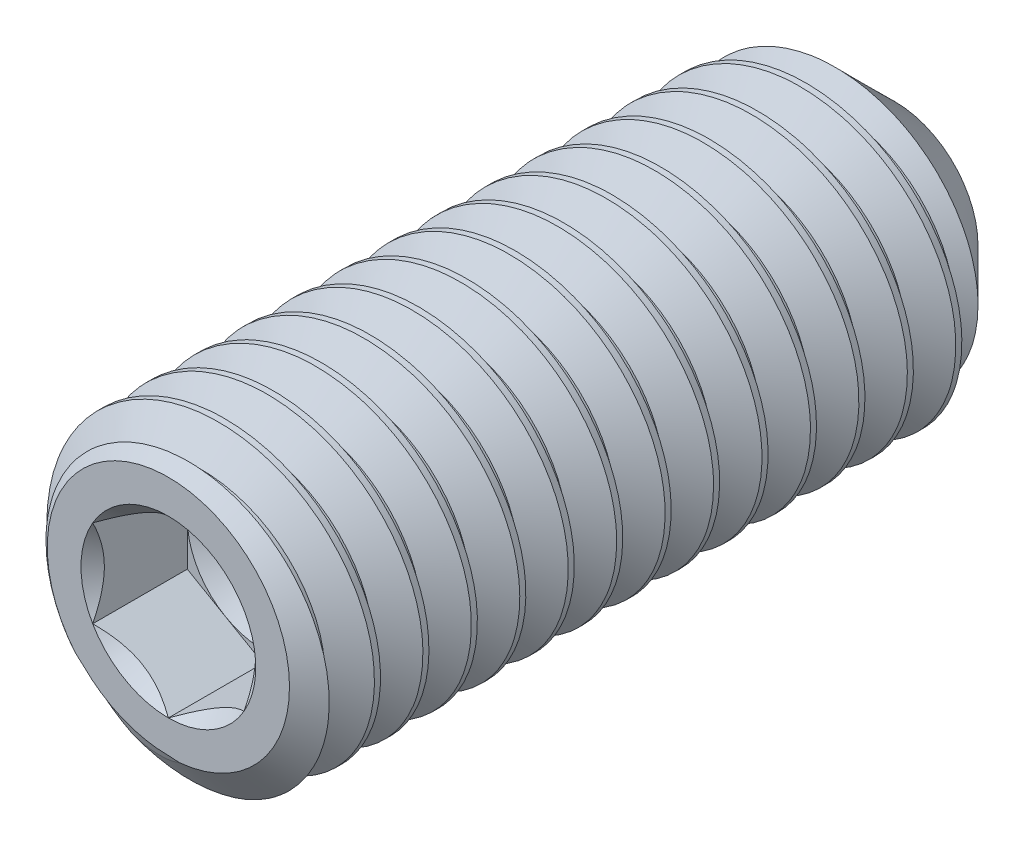
from build123d import *

# Parameters (mm, degrees)
CUT_SWEEP2_PITCH    = 0.8
CUT_EXTRUDE10_DEPTH = 1.5625


with BuildPart() as part:
    # Sketch22 → Revolve1 (revolve)
    with BuildSketch(Plane(origin=(0, 0, 0), x_dir=(0, 0, -1), z_dir=(1, 0, 0)), mode=Mode.PRIVATE) as revolve1_sk:
        Polygon((-5.588436834, 0), (-5.588436834, 2), (-5.238333065, 2.5), (5.281475432, 2.5), (6.411563166, 1.369912266), (5.588436834, 0), align=None)
    revolve(revolve1_sk.sketch.rotate(Axis((0, 0, -5.588436834), (0, 0, -1)), 180), axis=Axis((0, 0, -5.588436834), (0, 0, -1)))

    # Cut-Sweep2: the profile of Sketch28 profile screwed along a right-hand helix of 16 turns, 8 arcs to a turn; built about Z, then put on its axis
    cut_sweep2_z = Axis((0, 0, 0), (0, 0, 1))
    cut_sweep2_corners = [(2.5003, 0, 0.000173205), (2.5003, 0, -0.700173205), (1.980384758, 0, -0.4), (1.980384758, 0, -0.3)]
    with BuildLine(mode=Mode.PRIVATE) as cut_sweep2_profile:
        Line(cut_sweep2_corners[0], cut_sweep2_corners[1])
        Line(cut_sweep2_corners[1], cut_sweep2_corners[2])
        Line(cut_sweep2_corners[2], cut_sweep2_corners[3])
        Line(cut_sweep2_corners[3], cut_sweep2_corners[0])
    cut_sweep2_cap = Face(cut_sweep2_profile.wire())
    cut_sweep2_turn_angles = [0, 22.5, 45, 67.5, 90, 112.5, 135, 157.5, 180, 202.5, 225, 247.5, 270, 292.5, 315, 337.5, 360]
    cut_sweep2_turn_weights = [1, 0.9238795325112867, 1, 0.9238795325112867, 1, 0.9238795325112867, 1, 0.9238795325112867, 1, 0.9238795325112867, 1, 0.9238795325112867, 1, 0.9238795325112867, 1, 0.9238795325112867, 1]
    cut_sweep2_turn_rails = [Edge.make_bspline([Vector(p[0], p[1], 0).rotate(cut_sweep2_z, cut_sweep2_turn_angles[k]) / cut_sweep2_turn_weights[k] + Vector(0, 0, p[2] + CUT_SWEEP2_PITCH * cut_sweep2_turn_angles[k] / 360) for k in range(17)], [0, 0, 0, 1, 1, 2, 2, 3, 3, 4, 4, 5, 5, 6, 6, 7, 7, 8, 8, 8], 2, cut_sweep2_turn_weights) for p in cut_sweep2_corners]
    cut_sweep2_turn_sides = [Face.make_surface_from_curves(cut_sweep2_turn_rails[p[0]], cut_sweep2_turn_rails[p[1]]) for p in [(0, 1), (1, 2), (2, 3), (3, 0)]]
    cut_sweep2 = Plane(origin=(0, 0, -6.411563166), x_dir=(0, 1, 0), z_dir=(0, 0, 1)) * Solid(Shell([*[p.moved(Location((0, 0, CUT_SWEEP2_PITCH * i))) for i in range(16) for p in cut_sweep2_turn_sides], cut_sweep2_cap, cut_sweep2_cap.rotate(cut_sweep2_z, 5760).moved(Location((0, 0, CUT_SWEEP2_PITCH * 5760 / 360)))]))
    add(cut_sweep2, mode=Mode.SUBTRACT)

    # Sketch23 → Cut-Extrude10 (cut)
    with BuildSketch(Plane.XY.offset(5.588436834)):
        Polygon((0, 1.443375673), (-1.25, 0.721687836), (-1.25, -0.721687836), (0, -1.443375673), (1.25, -0.721687836), (1.25, 0.721687836), align=None)
    extrude(amount=-CUT_EXTRUDE10_DEPTH, mode=Mode.SUBTRACT)

    # Cut-Extrude11 cone 1 section (through the dimple's axis) → Cut-Extrude11 (revolve, cut)
    with BuildSketch(Plane(origin=(0, 0, 5.588436834), x_dir=(0, -1, 0), z_dir=(1, 0, 0))):
        Polygon((0, 0), (1.443375673, 0), (0, 1.443375673), align=None)
    revolve(axis=Axis((0, 0, 5.588436834), (0, 0, -1)), mode=Mode.SUBTRACT)

    # Cut-Extrude12 cone 1 section (through the dimple's axis) → Cut-Extrude12 (revolve, cut)
    with BuildSketch(Plane(origin=(0, 0, 4.025936834), x_dir=(0, -1, 0), z_dir=(1, 0, 0))):
        Polygon((0, 0), (1.25, 0), (0, 0.721687836), align=None)
    revolve(axis=Axis((0, 0, 4.025936834), (0, 0, -1)), mode=Mode.SUBTRACT)


solid = part.part
